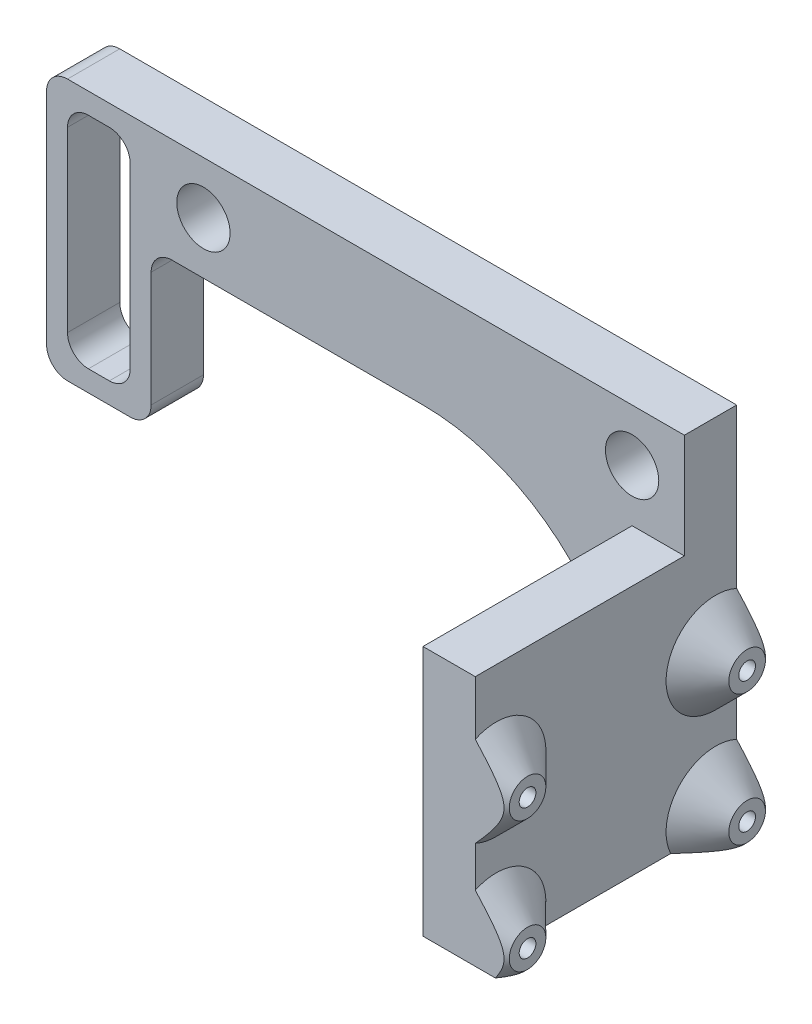
from build123d import *

# Parameters (mm, degrees)
SKETCH1_W                 = 51
SKETCH1_H                 = 10
SKETCH1_R                 = 2.55
BOSS_EXTRUDE1_DEPTH       = 5
SKETCH3_W                 = 10
SKETCH3_H                 = 25
SKETCH3_W_2               = 6
SKETCH3_H_2               = 21
BOSS_EXTRUDE2_DEPTH       = 5
SKETCH5_W                 = 25
SKETCH5_H                 = 24
BOSS_EXTRUDE3_DEPTH       = 5
FILLET1_R                 = 20
SKETCH6_R                 = 1.75
BOSS_EXTRUDE4_DEPTH       = 3
CHAMFER1_SIZE             = 3
M2X0_4_TAPPED_HOLE1_D     = 1.6
M2X0_4_TAPPED_HOLE1_DEPTH = 9.2
M2X0_4_TAPPED_HOLE1_TIP   = 0.480688495
FILLET2_R                 = 2


with BuildPart() as part:
    # Sketch1 → Boss-Extrude1 (new body)
    with BuildSketch(Plane.XY):
        with Locations((25.5, 5)):
            Rectangle(SKETCH1_W, SKETCH1_H)
        with Locations((5, 5)):
            Circle(SKETCH1_R, mode=Mode.SUBTRACT)
        with Locations((46, 5)):
            Circle(SKETCH1_R, mode=Mode.SUBTRACT)
    extrude(amount=BOSS_EXTRUDE1_DEPTH)

    # Sketch3 → Boss-Extrude2 (add)
    with BuildSketch(Plane.XY.offset(5)):
        with Locations((-5, -2.5)):
            Rectangle(SKETCH3_W, SKETCH3_H)
        with Locations((-5, -2.5)):
            Rectangle(SKETCH3_W_2, SKETCH3_H_2, mode=Mode.SUBTRACT)
    extrude(amount=-BOSS_EXTRUDE2_DEPTH)

    # Sketch5 → Boss-Extrude3 (add)
    with BuildSketch(Plane(origin=(51, 0, 0), x_dir=(0, 0, -1), z_dir=(1, 0, 0))):
        with Locations((-12.5, -12)):
            Rectangle(SKETCH5_W, SKETCH5_H)
    extrude(amount=-BOSS_EXTRUDE3_DEPTH)

    # Fillet1
    fillet1_edges = [part.edges().sort_by_distance(p)[0] for p in [
        (46, 0, 2.5),
    ]]
    fillet(fillet1_edges, radius=FILLET1_R)

    # Sketch6 → Boss-Extrude4 (add)
    with BuildSketch(Plane(origin=(51, 0, 0), x_dir=(0, 0, -1), z_dir=(1, 0, 0))):
        with Locations(Location((-23, -9.5, 0), (0, 0, 180))):
            Circle(SKETCH6_R)
        with Locations(Location((-23, -22, 0), (0, 0, 180))):
            Circle(SKETCH6_R)
        with Locations(Location((-2, -22, 0), (0, 0, 180))):
            Circle(SKETCH6_R)
        with Locations(Location((-2, -9.5, 0), (0, 0, 180))):
            Circle(SKETCH6_R)
    extrude(amount=BOSS_EXTRUDE4_DEPTH)

    # Chamfer1
    # the kernel refuses this chamfer: 3 mm, written as the material it adds along each edge
    with BuildSketch(Plane(origin=(51, -9.5, 23), x_dir=(0, 0, 1), z_dir=(0, 1, 0))) as chamfer1_piece_1_section:
        Polygon((1.75 + CHAMFER1_SIZE, 0), (1.75, CHAMFER1_SIZE), (1.75, 0), align=None)
    chamfer1_piece_1 = revolve(axis=Axis((51, -9.5, 23), (1, 0, 0)), mode=Mode.PRIVATE)
    chamfer1_piece_1 = split(chamfer1_piece_1, bisect_by=Plane(origin=(52.428955804, -9.5, 25), z_dir=(0, 0, -1)), keep=Keep.TOP, mode=Mode.PRIVATE)
    chamfer1_piece_1 = split(chamfer1_piece_1, bisect_by=Plane(origin=(54, -9.5, 19.736191383), z_dir=(-1, 0, 0)), keep=Keep.TOP, mode=Mode.PRIVATE)
    add(chamfer1_piece_1)
    with BuildSketch(Plane(origin=(51, -22, 23), x_dir=(0, 0, 1), z_dir=(0, 1, 0))) as chamfer1_piece_2_section:
        Polygon((1.75 + CHAMFER1_SIZE, 0), (1.75, CHAMFER1_SIZE), (1.75, 0), align=None)
    chamfer1_piece_2 = revolve(axis=Axis((51, -22, 23), (1, 0, 0)), mode=Mode.PRIVATE)
    chamfer1_piece_2 = split(chamfer1_piece_2, bisect_by=Plane(origin=(52.431534605, -24, 19.733612581), z_dir=(0, 1, 0)), keep=Keep.TOP, mode=Mode.PRIVATE)
    chamfer1_piece_2 = split(chamfer1_piece_2, bisect_by=Plane(origin=(52.431534605, -22, 25), z_dir=(0, 0, -1)), keep=Keep.TOP, mode=Mode.PRIVATE)
    chamfer1_piece_2 = split(chamfer1_piece_2, bisect_by=Plane(origin=(54, -22, 19.733612581), z_dir=(-1, 0, 0)), keep=Keep.TOP, mode=Mode.PRIVATE)
    add(chamfer1_piece_2)
    with BuildSketch(Plane(origin=(51, -22, 2), x_dir=(0, 0, 1), z_dir=(0, 1, 0))) as chamfer1_piece_3_section:
        Polygon((1.75 + CHAMFER1_SIZE, 0), (1.75, CHAMFER1_SIZE), (1.75, 0), align=None)
    chamfer1_piece_3 = revolve(axis=Axis((51, -22, 2), (1, 0, 0)), mode=Mode.PRIVATE)
    chamfer1_piece_3 = split(chamfer1_piece_3, bisect_by=Plane(origin=(53.459818879, -23.938254184, 0), z_dir=(0, 0, 1)), keep=Keep.TOP, mode=Mode.PRIVATE)
    chamfer1_piece_3 = split(chamfer1_piece_3, bisect_by=Plane(origin=(53.459818879, -24, 3.119051575), z_dir=(0, 1, 0)), keep=Keep.TOP, mode=Mode.PRIVATE)
    chamfer1_piece_3 = split(chamfer1_piece_3, bisect_by=Plane(origin=(54, -23.938254184, 3.119051575), z_dir=(-1, 0, 0)), keep=Keep.TOP, mode=Mode.PRIVATE)
    add(chamfer1_piece_3)
    with BuildSketch(Plane(origin=(51, -9.5, 2), x_dir=(0, 0, 1), z_dir=(0, 1, 0))) as chamfer1_piece_4_section:
        Polygon((1.75 + CHAMFER1_SIZE, 0), (1.75, CHAMFER1_SIZE), (1.75, 0), align=None)
    chamfer1_piece_4 = revolve(axis=Axis((51, -9.5, 2), (1, 0, 0)), mode=Mode.PRIVATE)
    chamfer1_piece_4 = split(chamfer1_piece_4, bisect_by=Plane(origin=(51.400671534, -13.217061478, 0), z_dir=(0, 0, 1)), keep=Keep.TOP, mode=Mode.PRIVATE)
    chamfer1_piece_4 = split(chamfer1_piece_4, bisect_by=Plane(origin=(54, -13.217061478, 4.146046445), z_dir=(-1, 0, 0)), keep=Keep.TOP, mode=Mode.PRIVATE)
    add(chamfer1_piece_4)

    # M2x0.4 Tapped Hole1
    with Locations(Plane(origin=(54, 0, 0), x_dir=(0, 0, -1), z_dir=(1, 0, 0))):
        with Locations((-23, -22), (-23, -9.5), (-2, -9.5), (-2, -22)):
            Hole(M2X0_4_TAPPED_HOLE1_D / 2, depth=M2X0_4_TAPPED_HOLE1_DEPTH)
            with Locations((0, 0, -(M2X0_4_TAPPED_HOLE1_DEPTH + M2X0_4_TAPPED_HOLE1_TIP / 2))):  # 118° drill point
                Cone(0, M2X0_4_TAPPED_HOLE1_D / 2, M2X0_4_TAPPED_HOLE1_TIP, mode=Mode.SUBTRACT)

    # Fillet2
    fillet2_edges = [part.edges().sort_by_distance(p)[0] for p in [
        (0, -15, 2.5),
        (-10, -15, 2.5),
        (-10, 10, 2.5),
        (-2, -13, 2.5),
        (-8, -13, 2.5),
        (-8, 8, 2.5),
        (-2, 8, 2.5),
        (0, 0, 2.5),
    ]]
    fillet(fillet2_edges, radius=FILLET2_R)


solid = part.part
